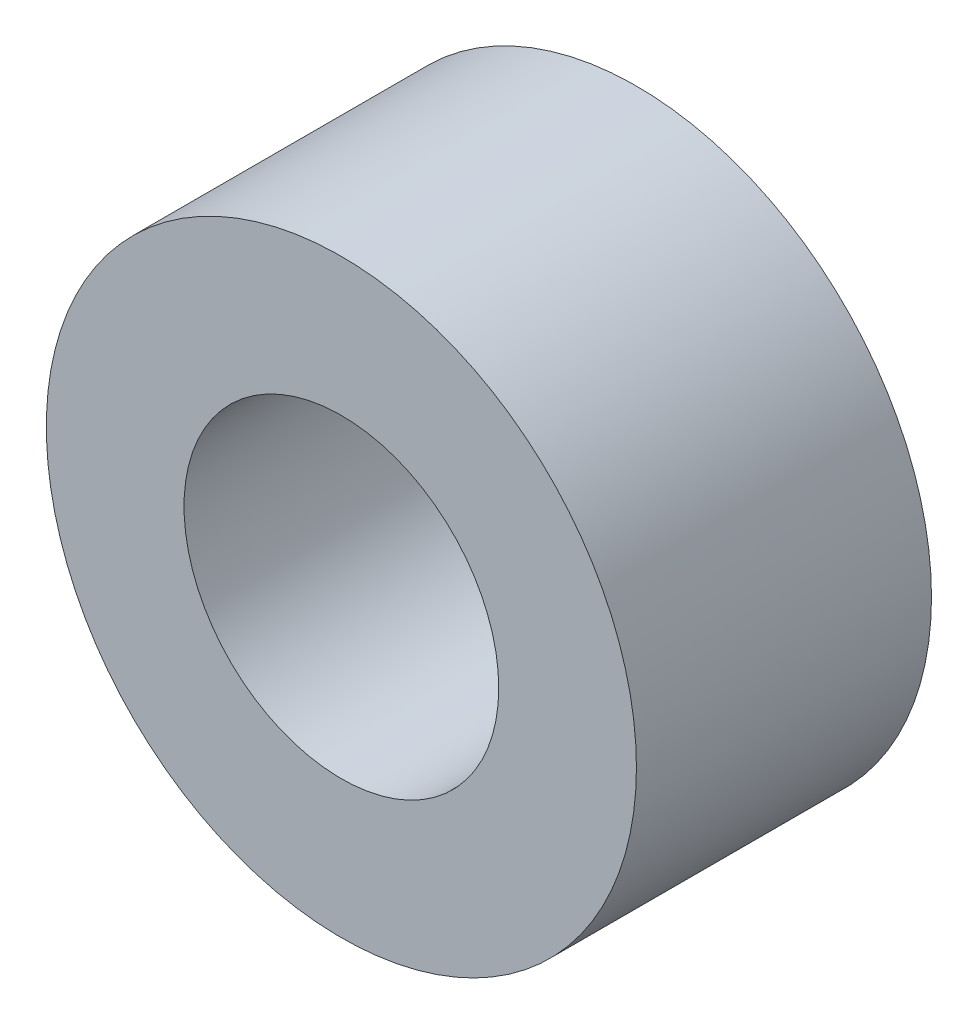
from build123d import *

# Parameters (mm, degrees)
SKETCH1_R      = 3
SKETCH1_R_2    = 1.6
EXTRUDE1_DEPTH = 1.5


with BuildPart() as part:
    # Sketch1 → Extrude1 (new, symmetric)
    with BuildSketch(Plane.XY):
        Circle(SKETCH1_R)
        Circle(SKETCH1_R_2, mode=Mode.SUBTRACT)
    extrude(amount=EXTRUDE1_DEPTH, both=True)


solid = part.part
